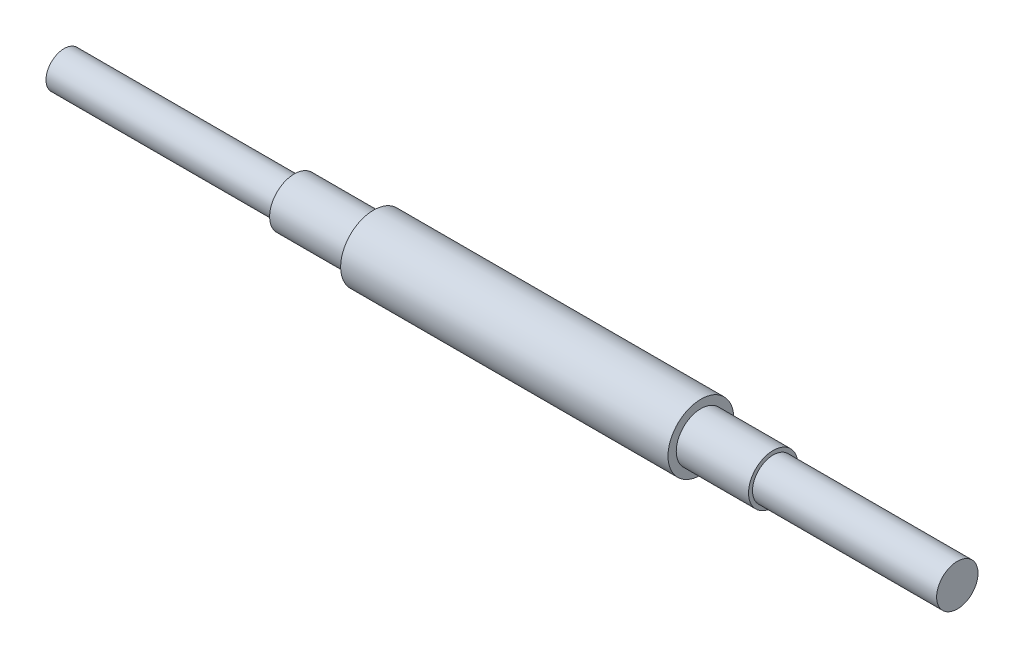
from build123d import *


with BuildPart() as part:
    # Sketch1 → Revolve1 (revolve)
    with BuildSketch(Plane(origin=(0, 0, 0), x_dir=(1, 0, 0), z_dir=(0, 1, 0))):
        Polygon((-78.63058905, 0), (-78.63058905, 3.499993), (-34.18058905, 3.499993), (-34.18058905, 4.7625), (-18.88145785, 4.7625), (-18.88145785, 6.35), (44.34422215, 6.35), (44.34422215, 4.7625), (58.307822112, 4.7625), (58.307822112, 3.99923), (93.867822112, 3.99923), (93.867822112, 0), align=None)
    revolve(axis=Axis((-97.950567047, 0, 0), (1, 0, 0)))


solid = part.part
